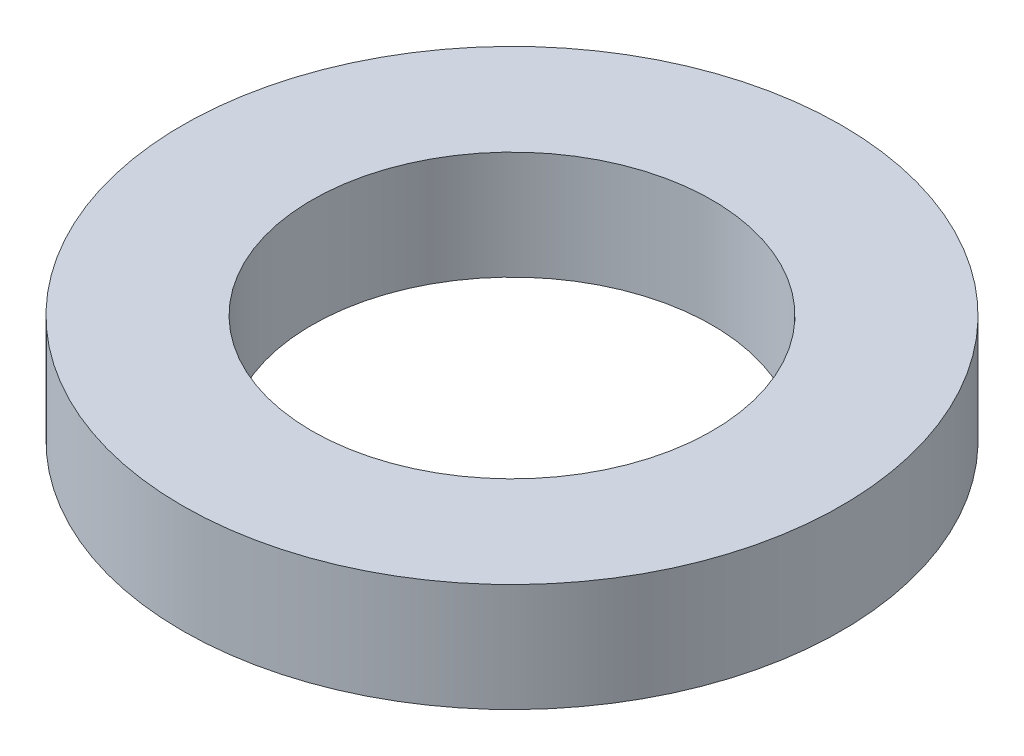
from build123d import *

# Parameters (mm, degrees)
SKETCH1_R           = 70
BOSS_EXTRUDE1_DEPTH = 23
SKETCH2_R           = 42.5
CUT_EXTRUDE1_DEPTH  = 102.631687972


with BuildPart() as part:
    # Sketch1 → Boss-Extrude1 (new body)
    with BuildSketch(Plane(origin=(0, 0, 0), x_dir=(1, 0, 0), z_dir=(0, 1, 0))):
        Circle(SKETCH1_R)
    extrude(amount=BOSS_EXTRUDE1_DEPTH)

    # Sketch2 → Cut-Extrude1 (cut, through all)
    with BuildSketch(Plane(origin=(0, 0, 0), x_dir=(1, 0, 0), z_dir=(0, 1, 0))):
        Circle(SKETCH2_R)
    extrude(amount=CUT_EXTRUDE1_DEPTH, mode=Mode.SUBTRACT)


solid = part.part
